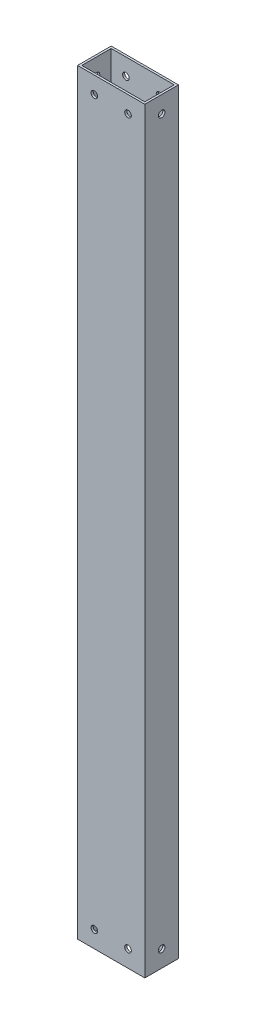
from build123d import *

# Parameters (mm, degrees)
SKETCH1_W               = 50.8
SKETCH1_H               = 571.5
BOSS_EXTRUDE1_DEPTH     = 12.7
SHELL1_T                = -1.5875
CUT_EXTRUDE1_DEPTH      = 288.157643987
CUT_EXTRUDE1_DEPTH_BACK = 288.157643987
SKETCH2_R               = 2.4892
CUT_EXTRUDE2_DEPTH      = 288.157643987
CUT_EXTRUDE2_DEPTH_BACK = 288.157643987
SKETCH3_R               = 2.4892


with BuildPart() as part:
    # Sketch1 → Boss-Extrude1 (new, symmetric)
    with BuildSketch(Plane.XY):
        Rectangle(SKETCH1_W, SKETCH1_H)
    extrude(amount=BOSS_EXTRUDE1_DEPTH, both=True)

    # Shell1
    shell1_openings = [part.faces().sort_by_distance(p)[0] for p in [
        (0, -285.75, 0),
        (0, 285.75, 0),
    ]]
    offset(amount=SHELL1_T, openings=shell1_openings, kind=Kind.INTERSECTION)

    # Sketch2 → Cut-Extrude1 (cut, two sides: drawn at the far end of the back side and taken through both)
    with BuildSketch(Plane.XY.offset(-CUT_EXTRUDE1_DEPTH_BACK)):
        with Locations((-12.7, -273.05)):
            Circle(SKETCH2_R)
        with Locations((12.7, -273.05)):
            Circle(SKETCH2_R)
        with Locations((12.7, 273.05)):
            Circle(SKETCH2_R)
        with Locations((-12.7, 273.05)):
            Circle(SKETCH2_R)
    extrude(amount=CUT_EXTRUDE1_DEPTH + CUT_EXTRUDE1_DEPTH_BACK, mode=Mode.SUBTRACT)

    # Sketch3 → Cut-Extrude2 (cut, two sides: drawn at the far end of the back side and taken through both)
    with BuildSketch(Plane(origin=(0, 0, 0), x_dir=(0, 0, -1), z_dir=(1, 0, 0)).offset(-CUT_EXTRUDE2_DEPTH_BACK)):
        with Locations((0, -273.05)):
            Circle(SKETCH3_R)
        with Locations((0, 273.05)):
            Circle(SKETCH3_R)
    extrude(amount=CUT_EXTRUDE2_DEPTH + CUT_EXTRUDE2_DEPTH_BACK, mode=Mode.SUBTRACT)


solid = part.part
